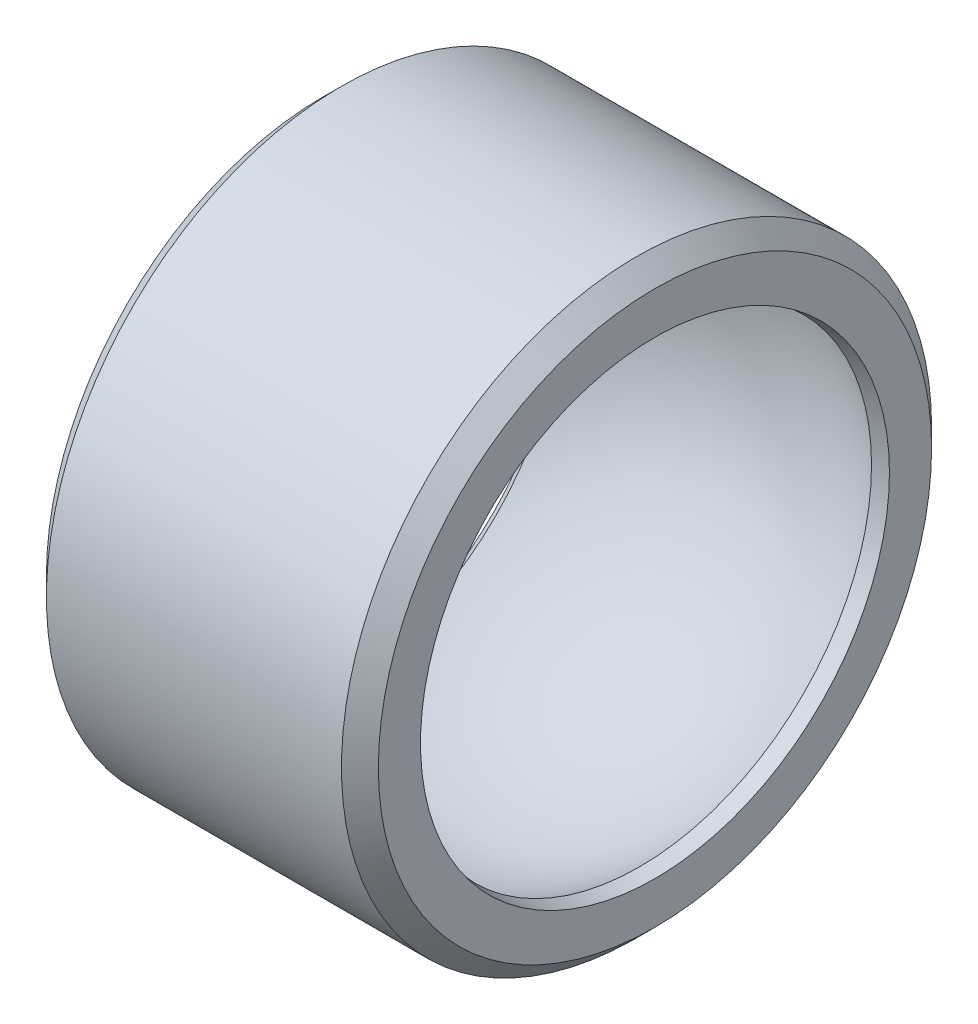
from build123d import *

# Parameters (mm, degrees)
SKETCH_1_R       = 8
EXTRUDE_1_DEPTH  = 9
CHAMFER_1_SIZE   = 0.357142857
CHAMFER_1_SIZE_2 = 0.5
CHAMFER_2_SIZE   = 0.5


with BuildPart() as part:
    # Эскиз1 → Бобышка-Вытянуть1 (new body)
    with BuildSketch(Plane(origin=(0, 0, 0), x_dir=(0, 0, -1), z_dir=(1, 0, 0))):
        Circle(SKETCH_1_R)
    extrude(amount=EXTRUDE_1_DEPTH)

    # Эскиз2 → Вырез-Повернуть1 (revolve, cut)
    with BuildSketch(Plane.XY):
        with BuildLine():
            Line((-3, 0), (12, 0))
            ThreePointArc((12, 0), (4.5, 7.5), (-3, 0))
        make_face()
    revolve(axis=Axis((0, 0, 0), (1, 0, 0)), mode=Mode.SUBTRACT)

    # Фаска1
    # the kernel refuses this chamfer: 0.5, 0.357142857 mm, written as the material it takes off along each edge
    with BuildSketch(Plane(origin=(9, 0, 0), x_dir=(0, 1, 0), z_dir=(0, 0, 1))) as chamfer_1_piece_1:
        with BuildLine():
            Line((6 + CHAMFER_1_SIZE, 0), (6.296419414, 0.425064103))
            ThreePointArc((6.296419414, 0.425064103), (6.1560674, 0.215979206), (6, 0))
            Line((6, 0), (6 + CHAMFER_1_SIZE, 0))
        make_face()
    revolve(axis=Axis((9, 0, 0), (-1, 0, 0)), mode=Mode.SUBTRACT)
    with BuildSketch(Plane(origin=(0, 0, 0), x_dir=(0, 1, 0), z_dir=(0, 0, 1))) as chamfer_1_piece_2:
        with BuildLine():
            Line((6 + CHAMFER_1_SIZE_2, 0), (6.208166664, -0.291833336))
            ThreePointArc((6.208166664, -0.291833336), (6.10678692, -0.146018659), (6, 0))
            Line((6, 0), (6 + CHAMFER_1_SIZE_2, 0))
        make_face()
    revolve(axis=Axis((0, 0, 0), (-1, 0, 0)), mode=Mode.SUBTRACT)

    # Фаска2
    chamfer_2_edges = [part.edges().sort_by_distance(p)[0] for p in [
        (0, 0, 8),
        (9, 0, 8),
    ]]
    chamfer(chamfer_2_edges, length=CHAMFER_2_SIZE)


solid = part.part
